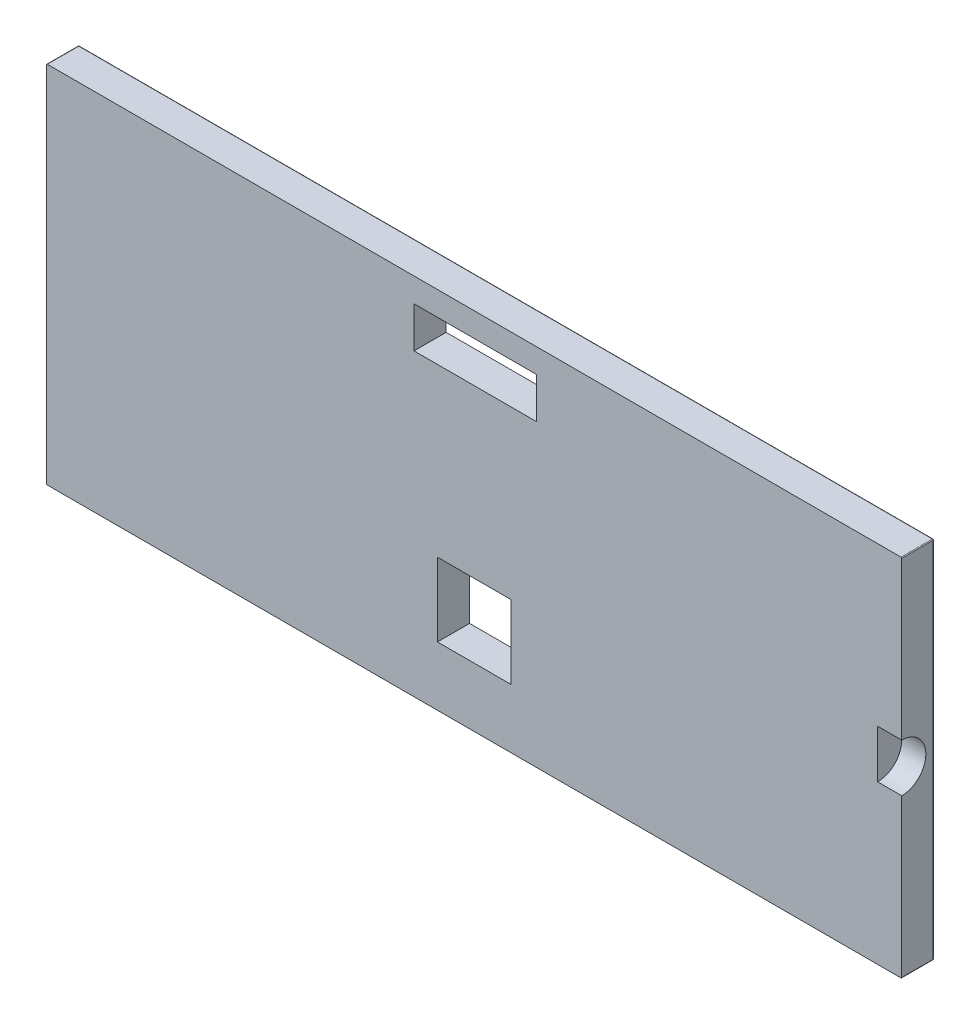
from build123d import *

# Parameters (mm, degrees)
BOSS_EXTRUDE1_DEPTH      = 76.2
BOSS_EXTRUDE1_DEPTH_BACK = 25.4
SKETCH1_W                = 2704.084
SKETCH1_H                = 1152.398
SKETCH1_W_2              = 387.096
SKETCH1_H_2              = 129.032
SKETCH1_W_3              = 232.2576
SKETCH1_H_3              = 232.2576
SKETCH2_R                = 76.2
CUT_EXTRUDE1_DEPTH       = 76.2
FILLET1_R                = 2.54


with BuildPart() as part:
    # Sketch1 → Boss-Extrude1 (new, two sides: drawn at the far end of the back side and taken through both)
    with BuildSketch(Plane.XY.offset(-BOSS_EXTRUDE1_DEPTH_BACK)):
        with Locations((1352.042, 576.199)):
            Rectangle(SKETCH1_W, SKETCH1_H)
        with Locations((1355.344, 1011.682)):
            Rectangle(SKETCH1_W_2, SKETCH1_H_2, mode=Mode.SUBTRACT)
        with Locations((1352.042, 303.276)):
            Rectangle(SKETCH1_W_3, SKETCH1_H_3, mode=Mode.SUBTRACT)
    extrude(amount=BOSS_EXTRUDE1_DEPTH + BOSS_EXTRUDE1_DEPTH_BACK)

    # Sketch2 → Cut-Extrude1 (cut)
    with BuildSketch(Plane(origin=(2704.084, 0, 0), x_dir=(0, 0, -1), z_dir=(1, 0, 0))):
        with Locations((-76.2, 576.199)):
            Circle(SKETCH2_R)
    extrude(amount=-CUT_EXTRUDE1_DEPTH, mode=Mode.SUBTRACT)

    # Fillet1
    fillet1_edges = [part.edges().sort_by_distance(p)[0] for p in [
        (1352.042, 0, -25.4),
        (2704.084, 576.199, -25.4),
        (1352.042, 1152.398, -25.4),
        (0, 576.199, -25.4),
        (0, 1152.398, 25.4),
        (0, 0, 25.4),
        (2704.084, 0, 25.4),
        (2704.084, 1152.398, 25.4),
    ]]
    fillet(fillet1_edges, radius=FILLET1_R)


solid = part.part
